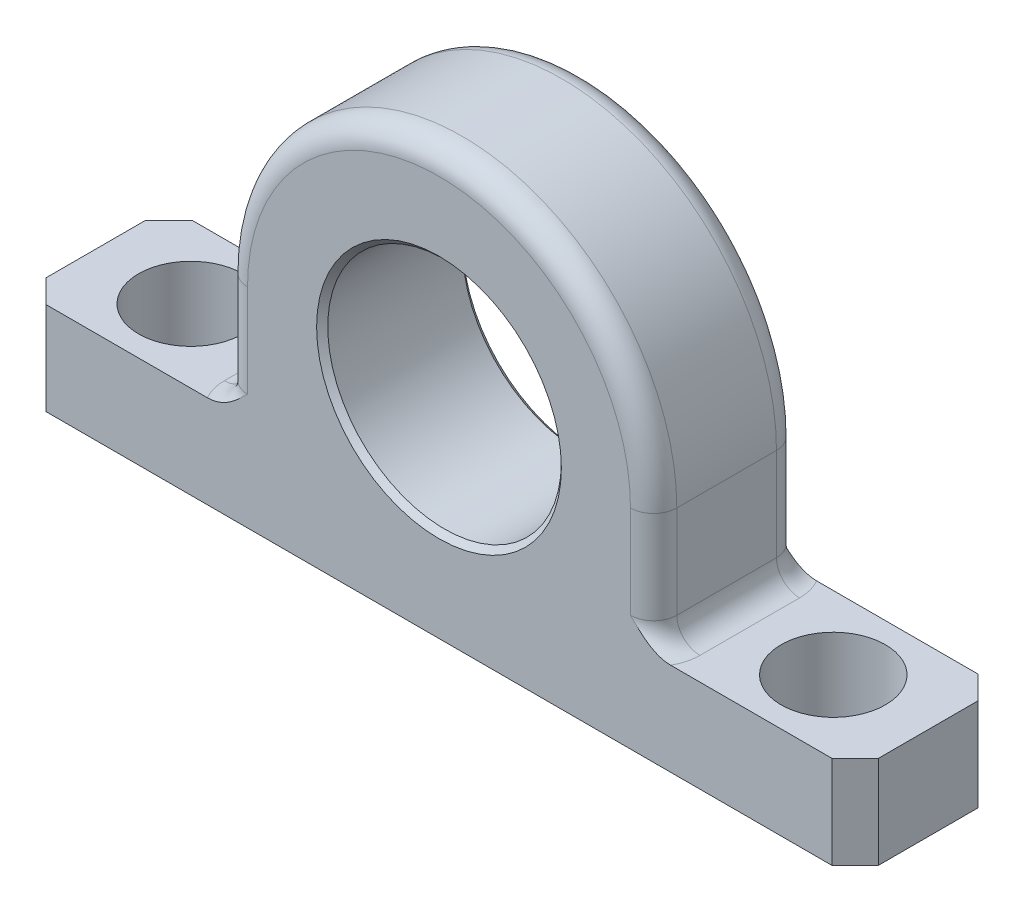
from build123d import *

# Parameters (mm, degrees)
SKETCH2_R          = 8
BODY_EXTRUDE_DEPTH = 5
BODY_FILLET_A_R    = 1.5875
BODY_FILLET_B_R    = 1.5875
CHAMFER2_SIZE      = 1.5875
ID_CHAMFER_SIZE    = 0.381
SKETCH3_R          = 3.571875
HOLE_CUT_DEPTH     = 37.746054285


with BuildPart() as part:
    # Sketch2 → Body Extrude (new, symmetric)
    with BuildSketch(Plane.XY):
        with BuildLine():
            Line((-28.5, 0), (-28.5, 6.35))
            Line((-28.5, 6.35), (-14.7, 6.35))
            Line((-14.7, 6.35), (-14.7, 14.3))
            ThreePointArc((-14.7, 14.3), (0, 29), (14.7, 14.3))
            Line((14.7, 14.3), (14.7, 6.35))
            Line((14.7, 6.35), (28.5, 6.35))
            Line((28.5, 6.35), (28.5, 0))
            Line((28.5, 0), (-28.5, 0))
        make_face()
        with Locations((0, 14.3)):
            Circle(SKETCH2_R, mode=Mode.SUBTRACT)
    extrude(amount=BODY_EXTRUDE_DEPTH, both=True)

    # Body Fillet A
    body_fillet_a_edges = [part.edges().sort_by_distance(p)[0] for p in [
        (14.7, 10.325, 5),
        (0, 29, 5),
        (-14.7, 10.325, 5),
        (-14.7, 10.325, -5),
        (0, 29, -5),
        (14.7, 10.325, -5),
    ]]
    fillet(body_fillet_a_edges, radius=BODY_FILLET_A_R)

    # Body Fillet B
    # the kernel refuses this fillet: 1.5875 mm, written as the material it adds along each edge
    with BuildSketch(Plane(origin=(-14.7, 6.35, 3.4125), x_dir=(0, 1, 0), z_dir=(0, 0, -1))) as body_fillet_b_piece_1:
        with BuildLine():
            CenterArc((BODY_FILLET_B_R, -BODY_FILLET_B_R), BODY_FILLET_B_R, 90, 90)
            Line((0, -BODY_FILLET_B_R), (0, 0))
            Line((0, 0), (BODY_FILLET_B_R, 0))
        make_face()
    extrude(amount=6.825)
    with BuildSketch(Plane(origin=(14.7, 6.35, 3.4125), x_dir=(0, 1, 0), z_dir=(0, 0, -1))) as body_fillet_b_piece_2:
        with BuildLine():
            CenterArc((BODY_FILLET_B_R, BODY_FILLET_B_R), BODY_FILLET_B_R, 180, 90)
            Line((0, BODY_FILLET_B_R), (0, 0))
            Line((0, 0), (BODY_FILLET_B_R, 0))
        make_face()
    extrude(amount=6.825)
    with BuildSketch(Plane(origin=(-13.1125, 6.35, -3.4125), x_dir=(-1, 0, 0), z_dir=(0, 0, 1))) as body_fillet_b_piece_3_section:
        with BuildLine():
            CenterArc((1.5875 + BODY_FILLET_B_R, -BODY_FILLET_B_R), BODY_FILLET_B_R, 90, 90)
            Line((1.5875 + BODY_FILLET_B_R, 0), (1.5875, 0))
            Line((1.5875, 0), (1.5875, -BODY_FILLET_B_R))
        make_face()
    body_fillet_b_piece_3 = revolve(axis=Axis((-13.1125, 6.35, -3.4125), (0, -1, 0)), revolution_arc=233.296989237, mode=Mode.PRIVATE)
    body_fillet_b_piece_3 = split(body_fillet_b_piece_3, bisect_by=Plane(origin=(-14.303028138, 6.844709666, -5), z_dir=(0, 0, 1)), keep=Keep.TOP, mode=Mode.PRIVATE)
    add(body_fillet_b_piece_3)
    with BuildSketch(Plane(origin=(13.1125, 6.35, 3.4125), x_dir=(-0.597667277632828, 0, -0.8017442392976478), z_dir=(0.8017442392976478, 0, -0.597667277632828))) as body_fillet_b_piece_4_section:
        with BuildLine():
            CenterArc((1.5875 + BODY_FILLET_B_R, BODY_FILLET_B_R), BODY_FILLET_B_R, 180, 90)
            Line((1.5875, BODY_FILLET_B_R), (1.5875, 0))
            Line((1.5875, 0), (1.5875 + BODY_FILLET_B_R, 0))
        make_face()
    body_fillet_b_piece_4 = revolve(axis=Axis((13.1125, 6.35, 3.4125), (0, 1, 0)), revolution_arc=233.296989237, mode=Mode.PRIVATE)
    body_fillet_b_piece_4 = split(body_fillet_b_piece_4, bisect_by=Plane(origin=(14.303027956, 6.844710216, 5), z_dir=(0, 0, -1)), keep=Keep.TOP, mode=Mode.PRIVATE)
    add(body_fillet_b_piece_4)
    with BuildSketch(Plane(origin=(13.1125, 6.35, -3.4125), x_dir=(1, 0, 0), z_dir=(0, 0, 1))) as body_fillet_b_piece_5_section:
        with BuildLine():
            CenterArc((1.5875 + BODY_FILLET_B_R, BODY_FILLET_B_R), BODY_FILLET_B_R, 180, 90)
            Line((1.5875 + BODY_FILLET_B_R, 0), (1.5875, 0))
            Line((1.5875, 0), (1.5875, BODY_FILLET_B_R))
        make_face()
    body_fillet_b_piece_5 = revolve(axis=Axis((13.1125, 6.35, -3.4125), (0, 1, 0)), revolution_arc=233.296989237, mode=Mode.PRIVATE)
    body_fillet_b_piece_5 = split(body_fillet_b_piece_5, bisect_by=Plane(origin=(14.303027986, 6.84471004, -5), z_dir=(0, 0, 1)), keep=Keep.TOP, mode=Mode.PRIVATE)
    add(body_fillet_b_piece_5)
    with BuildSketch(Plane(origin=(-13.1125, 6.35, 3.4125), x_dir=(0.597667277632828, 0, -0.8017442392976478), z_dir=(-0.8017442392976478, 0, -0.597667277632828))) as body_fillet_b_piece_6_section:
        with BuildLine():
            CenterArc((1.5875 + BODY_FILLET_B_R, -BODY_FILLET_B_R), BODY_FILLET_B_R, 90, 90)
            Line((1.5875 + BODY_FILLET_B_R, 0), (1.5875, 0))
            Line((1.5875, 0), (1.5875, -BODY_FILLET_B_R))
        make_face()
    body_fillet_b_piece_6 = revolve(axis=Axis((-13.1125, 6.35, 3.4125), (0, -1, 0)), revolution_arc=233.296989237, mode=Mode.PRIVATE)
    body_fillet_b_piece_6 = split(body_fillet_b_piece_6, bisect_by=Plane(origin=(-14.30302807, 6.844709941, 5), z_dir=(0, 0, -1)), keep=Keep.TOP, mode=Mode.PRIVATE)
    add(body_fillet_b_piece_6)

    # Chamfer2
    chamfer2_edges = [part.edges().sort_by_distance(p)[0] for p in [
        (28.5, 3.175, -5),
        (-28.5, 3.175, 5),
        (28.5, 3.175, 5),
        (-28.5, 3.175, -5),
    ]]
    chamfer(chamfer2_edges, length=CHAMFER2_SIZE)

    # ID Chamfer
    id_chamfer_edges = [part.edges().sort_by_distance(p)[0] for p in [
        (-8, 14.3, -5),
        (-8, 14.3, 5),
    ]]
    chamfer(id_chamfer_edges, length=ID_CHAMFER_SIZE)

    # Sketch3 → Hole Cut (cut, through all)
    with BuildSketch(Plane(origin=(0, 6.35, 0), x_dir=(1, 0, 0), z_dir=(0, 1, 0))):
        with Locations(Location((-22, 0, 0), (0, 0, 180))):
            Circle(SKETCH3_R)
        with Locations((22, 0)):
            Circle(SKETCH3_R)
    extrude(amount=-HOLE_CUT_DEPTH, mode=Mode.SUBTRACT)


solid = part.part
